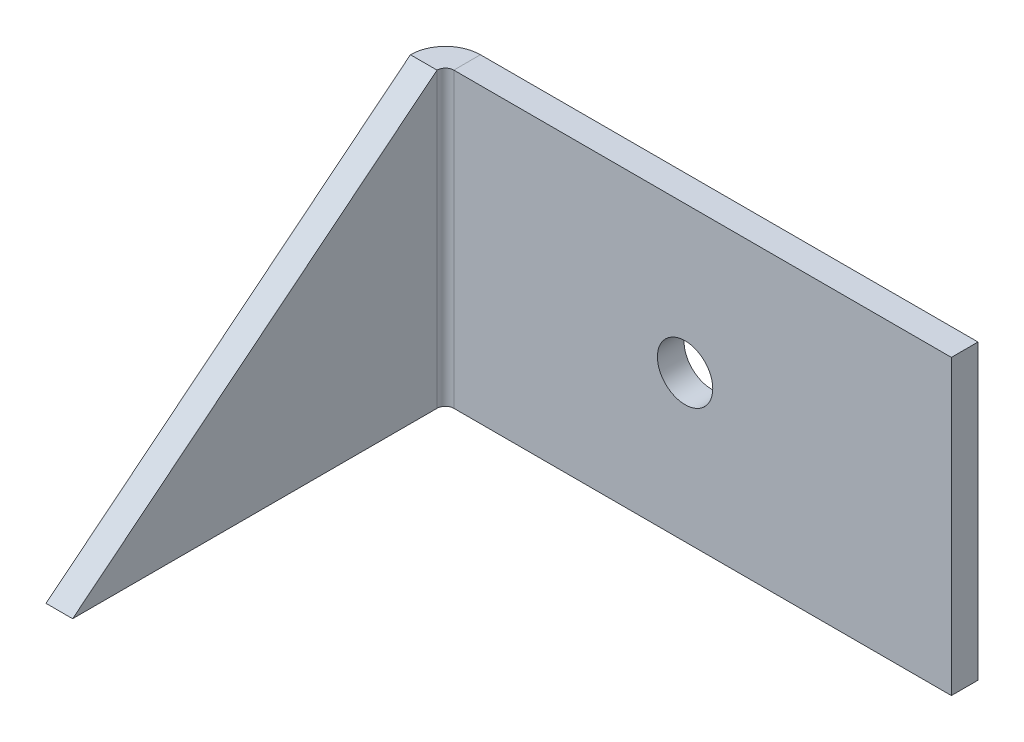
from build123d import *

# Parameters (mm, degrees)
SKETCH2_W                    = 57.15
SKETCH2_H                    = 34.925
BASE_FLANGE1_DEPTH           = 3.175
M6_CLEARANCE_HOLE1_D         = 6.6
EDGE_FLANGE2_STRIP_W         = 14.7
EDGE_FLANGE2_STRIP_H         = 3.175
EDGE_FLANGE2_STRIP_CUT_DEPTH = 34.925
EDGE_FLANGE2_DEPTH           = 34.925
CUT_EXTRUDE2_DEPTH           = 79.817416579
SKETCH21_W                   = 3.175
SKETCH21_H                   = 34.925
BOSS_EXTRUDE1_DEPTH          = 3.175


# Sheet-metal steps are written as plain solids
with BuildPart() as part:
    # Sketch2 → Base-Flange1 (new body)
    with BuildSketch(Plane.XY):
        Rectangle(SKETCH2_W, SKETCH2_H)
    extrude(amount=BASE_FLANGE1_DEPTH)

    # M6 Clearance Hole1 (through all)
    with Locations(Plane.XY.offset(3.175)):
        with Locations((0, 0)):
            Hole(M6_CLEARANCE_HOLE1_D / 2)

    # Edge-Flange2 strip (across the edge) → Edge-Flange2 strip cut (cut)
    with BuildSketch(Plane(origin=(-28.575, 17.4625, 3.175), x_dir=(1, 0, 0), z_dir=(0, -1, 0))):
        with Locations((-6.35, -1.5875)):
            Rectangle(EDGE_FLANGE2_STRIP_W, EDGE_FLANGE2_STRIP_H)
    extrude(amount=EDGE_FLANGE2_STRIP_CUT_DEPTH, mode=Mode.SUBTRACT)

    # Edge-Flange2 section (across the edge) → Edge-Flange2 (add)
    with BuildSketch(Plane(origin=(-28.575, 17.4625, 3.175), x_dir=(1, 0, 0), z_dir=(0, -1, 0))):
        with BuildLine():
            Line((-3.175, 1), (-3.175, 44.45))
            Line((-3.175, 44.45), (0, 44.45))
            Line((0, 44.45), (0, 1))
            ThreePointArc((0, 1), (0.292893219, 0.292893219), (1, 0))
            Line((1, 0), (1, -3.175))
            ThreePointArc((1, -3.175), (-1.952170811, -1.952170811), (-3.175, 1))
        make_face()
    extrude(amount=EDGE_FLANGE2_DEPTH)

    # Sketch20 → Cut-Extrude2 (cut, through all)
    with BuildSketch(Plane.ZY.offset(31.75)):
        Polygon((4.175, 17.4625), (47.625, -17.4625), (47.625, 17.4625), align=None)
    extrude(amount=-CUT_EXTRUDE2_DEPTH, mode=Mode.SUBTRACT)

    # Sketch21 → Boss-Extrude1 (add)
    with BuildSketch(Plane(origin=(28.575, 0, 0), x_dir=(0, 0, -1), z_dir=(1, 0, 0))):
        with Locations((-1.5875, 0)):
            Rectangle(SKETCH21_W, SKETCH21_H)
    extrude(amount=BOSS_EXTRUDE1_DEPTH)


solid = part.part
